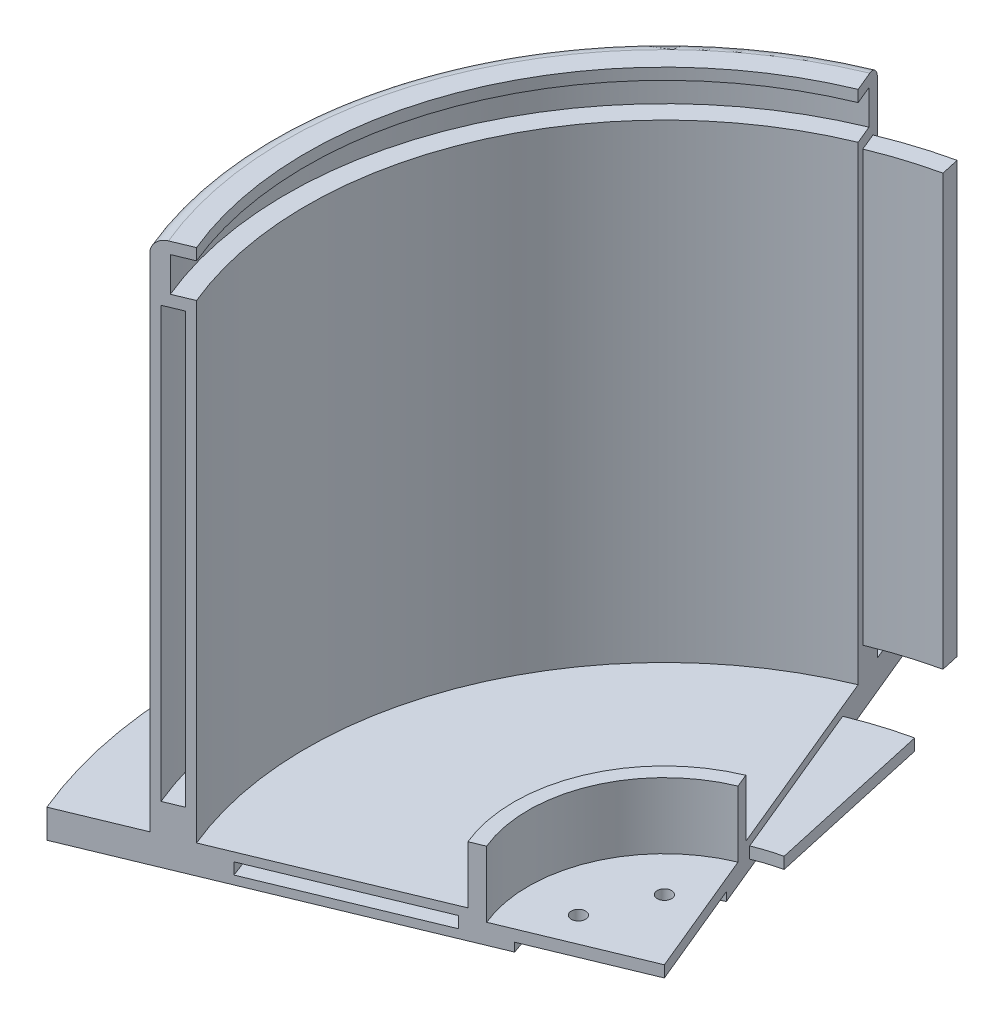
from build123d import *

# Parameters (mm, degrees)
SKETCH1_R           = 137.5
SKETCH1_R_2         = 125
BOSS_EXTRUDE1_DEPTH = 180
SKETCH2_R           = 165
SKETCH2_R_2         = 2.5
BOSS_EXTRUDE2_DEPTH = 10
SKETCH3_R           = 52.5
SKETCH3_R_2         = 47.5
BOSS_EXTRUDE3_DEPTH = 20
SKETCH4_W           = 56
SKETCH4_H           = 96
CUT_EXTRUDE4_DEPTH  = 150
SKETCH5_W           = 56
SKETCH5_H           = 10
BOSS_EXTRUDE4_DEPTH = 56
SKETCH6_W           = 56
SKETCH6_H           = 56
BOSS_EXTRUDE5_DEPTH = 10
SKETCH7_R           = 2.5
SKETCH7_R_2         = 12.5
CUT_EXTRUDE5_DEPTH  = 10
SKETCH8_W           = 56
SKETCH8_H           = 86
BOSS_EXTRUDE6_DEPTH = 5
FILLET1_R           = 10
FILLET2_R           = 5
SKETCH9_W           = 31.730677801
SKETCH9_H           = 6
CUT_EXTRUDE6_DEPTH  = 10
FILLET3_R           = 5
CUT_EXTRUDE7_START  = -3
SKETCH10_R          = 47.5
CUT_EXTRUDE7_DEPTH  = 3
SKETCH11_R          = 5
CUT_EXTRUDE8_DEPTH  = 5
SKETCH13_W          = 14
SKETCH13_H          = 12
CUT_EXTRUDE9_DEPTH  = 301.915270467
SKETCH15_W          = 6.5
SKETCH15_H          = 150
SKETCH15_W_2        = 60
SKETCH15_H_2        = 4
REVOLVE1_ANGLE      = 10
SKETCH16_W          = 6.5
SKETCH16_H          = 150
SKETCH16_W_2        = 60
SKETCH16_H_2        = 4
CUT_REVOLVE2_ANGLE  = 10
SKETCH17_R          = 40
CUT_EXTRUDE10_DEPTH = 3


with BuildPart() as part:
    # Sketch1 → Boss-Extrude1 (new body)
    with BuildSketch(Plane(origin=(0, 0, 0), x_dir=(1, 0, 0), z_dir=(0, 1, 0))):
        with Locations(Location((0, 0, 0), (0, 0, 90))):
            Circle(SKETCH1_R)
        with Locations(Location((0, 0, 0), (0, 0, 90))):
            Circle(SKETCH1_R_2, mode=Mode.SUBTRACT)
    extrude(amount=BOSS_EXTRUDE1_DEPTH)

    # Sketch2 → Boss-Extrude2 (add)
    with BuildSketch(Plane.XZ):
        with Locations(Location((0, 0, 0), (0, 0, 270))):
            Circle(SKETCH2_R)
        with Locations(Location((0, 150, 0), (0, 0, 270))):
            Circle(SKETCH2_R_2, mode=Mode.SUBTRACT)
        with Locations(Location((0, 30, 0), (0, 0, 270))):
            Circle(SKETCH2_R_2, mode=Mode.SUBTRACT)
        with Locations(Location((106.066017178, 106.066017178, 0), (0, 0, 270))):
            Circle(SKETCH2_R_2, mode=Mode.SUBTRACT)
        with Locations(Location((150, 0, 0), (0, 0, 270))):
            Circle(SKETCH2_R_2, mode=Mode.SUBTRACT)
        with Locations(Location((106.066017178, -106.066017178, 0), (0, 0, 270))):
            Circle(SKETCH2_R_2, mode=Mode.SUBTRACT)
        with Locations(Location((0, -150, 0), (0, 0, 270))):
            Circle(SKETCH2_R_2, mode=Mode.SUBTRACT)
        with Locations(Location((-106.066017178, -106.066017178, 0), (0, 0, 270))):
            Circle(SKETCH2_R_2, mode=Mode.SUBTRACT)
        with Locations(Location((-150, 0, 0), (0, 0, 270))):
            Circle(SKETCH2_R_2, mode=Mode.SUBTRACT)
        with Locations(Location((-106.066017178, 106.066017178, 0), (0, 0, 270))):
            Circle(SKETCH2_R_2, mode=Mode.SUBTRACT)
        with Locations(Location((21.213203436, 21.213203436, 0), (0, 0, 270))):
            Circle(SKETCH2_R_2, mode=Mode.SUBTRACT)
        with Locations(Location((30, 0, 0), (0, 0, 270))):
            Circle(SKETCH2_R_2, mode=Mode.SUBTRACT)
        with Locations(Location((21.213203436, -21.213203436, 0), (0, 0, 270))):
            Circle(SKETCH2_R_2, mode=Mode.SUBTRACT)
        with Locations(Location((0, -30, 0), (0, 0, 270))):
            Circle(SKETCH2_R_2, mode=Mode.SUBTRACT)
        with Locations(Location((-21.213203436, -21.213203436, 0), (0, 0, 270))):
            Circle(SKETCH2_R_2, mode=Mode.SUBTRACT)
        with Locations(Location((-30, 0, 0), (0, 0, 270))):
            Circle(SKETCH2_R_2, mode=Mode.SUBTRACT)
        with Locations(Location((-21.213203436, 21.213203436, 0), (0, 0, 270))):
            Circle(SKETCH2_R_2, mode=Mode.SUBTRACT)
    extrude(amount=BOSS_EXTRUDE2_DEPTH)

    # Sketch3 → Boss-Extrude3 (add)
    with BuildSketch(Plane(origin=(0, 0, 0), x_dir=(1, 0, 0), z_dir=(0, 1, 0))):
        with Locations(Location((0, 0, 0), (0, 0, 90))):
            Circle(SKETCH3_R)
        with Locations(Location((0, 0, 0), (0, 0, 270))):
            Circle(SKETCH3_R_2, mode=Mode.SUBTRACT)
    extrude(amount=BOSS_EXTRUDE3_DEPTH)

    # Sketch4 → Cut-Extrude4 (cut)
    with BuildSketch(Plane(origin=(0, 0, 0), x_dir=(0, 0, -1), z_dir=(1, 0, 0))):
        with Locations((0, 112)):
            Rectangle(SKETCH4_W, SKETCH4_H)
    extrude(amount=CUT_EXTRUDE4_DEPTH, mode=Mode.SUBTRACT)

    # Sketch5 → Boss-Extrude4 (add)
    with BuildSketch(Plane(origin=(0, 0, 28), x_dir=(-1, 0, 0), z_dir=(0, 0, -1))):
        with Locations((-121.823643025, 135)):
            Rectangle(SKETCH5_W, SKETCH5_H)
    extrude(amount=BOSS_EXTRUDE4_DEPTH)

    # Sketch6 → Boss-Extrude5 (add)
    with BuildSketch(Plane(origin=(0, 64, 0), x_dir=(1, 0, 0), z_dir=(0, 1, 0))):
        with Locations((121.823643025, 0)):
            Rectangle(SKETCH6_W, SKETCH6_H)
    extrude(amount=-BOSS_EXTRUDE5_DEPTH)

    # Sketch7 → Cut-Extrude5 (cut)
    with BuildSketch(Plane(origin=(0, 140, 0), x_dir=(1, 0, 0), z_dir=(0, 1, 0))):
        with Locations(Location((98.273643025, 23.55, 0), (0, 0, 270))):
            Circle(SKETCH7_R)
        with Locations(Location((145.373643025, 23.55, 0), (0, 0, 270))):
            Circle(SKETCH7_R)
        with Locations(Location((98.273643025, -23.55, 0), (0, 0, 270))):
            Circle(SKETCH7_R)
        with Locations(Location((145.373643025, -23.55, 0), (0, 0, 270))):
            Circle(SKETCH7_R)
        with Locations(Location((121.823643025, 0, 0), (0, 0, 270))):
            Circle(SKETCH7_R_2)
    extrude(amount=-CUT_EXTRUDE5_DEPTH, mode=Mode.SUBTRACT)

    # Sketch8 → Boss-Extrude6 (add)
    with BuildSketch(Plane(origin=(149.823643025, 0, 0), x_dir=(0, 0, -1), z_dir=(1, 0, 0))):
        with Locations((0, 97)):
            Rectangle(SKETCH8_W, SKETCH8_H)
    extrude(amount=BOSS_EXTRUDE6_DEPTH)

    # Fillet1
    # the kernel refuses this fillet: 10 mm, written as the material it takes off along each edge
    with BuildSketch(Plane(origin=(154.823643025, 165, -28), x_dir=(0, 0, 1), z_dir=(0, -1, 0))) as fillet1_piece_1:
        with BuildLine():
            CenterArc((FILLET1_R, FILLET1_R), FILLET1_R, 180, 90)
            Line((0, FILLET1_R), (0, 0))
            Line((0, 0), (FILLET1_R, 0))
        make_face()
    extrude(amount=136, mode=Mode.SUBTRACT)
    with BuildSketch(Plane(origin=(154.823643025, 29, 28), x_dir=(-1, 0, 0), z_dir=(0, 1, 0))) as fillet1_piece_2:
        with BuildLine():
            CenterArc((FILLET1_R, -FILLET1_R), FILLET1_R, 90, 90)
            Line((0, -FILLET1_R), (0, 0))
            Line((0, 0), (FILLET1_R, 0))
        make_face()
    extrude(amount=136, mode=Mode.SUBTRACT)

    # Fillet2
    fillet2_edges = [part.edges().sort_by_distance(p)[0] for p in [
        (93.823643025, 59, 28),
        (93.823643025, 59, -28),
        (93.823643025, 135, -28),
        (93.823643025, 135, 28),
    ]]
    fillet(fillet2_edges, radius=FILLET2_R)

    # Sketch9 → Cut-Extrude6 (cut)
    with BuildSketch(Plane(origin=(0, 140, 0), x_dir=(1, 0, 0), z_dir=(0, 1, 0))):
        with Locations((93.823643026, 0)):
            Rectangle(SKETCH9_W, SKETCH9_H)
    extrude(amount=-CUT_EXTRUDE6_DEPTH, mode=Mode.SUBTRACT)

    # Fillet3
    fillet3_edges = [part.edges().sort_by_distance(p)[0] for p in [
        (0, 180, 137.5),
    ]]
    fillet(fillet3_edges, radius=FILLET3_R)

    # Sketch10 → Cut-Extrude7 (cut)
    with BuildSketch(Plane(origin=(0, 0, 0), x_dir=(1, 0, 0), z_dir=(0, 1, 0)).offset(CUT_EXTRUDE7_START)):
        with Locations(Location((0, 0, 0), (0, 0, 270))):
            Circle(SKETCH10_R)
    extrude(amount=CUT_EXTRUDE7_DEPTH, mode=Mode.SUBTRACT)

    # Sketch11 → Cut-Extrude8 (cut)
    with BuildSketch(Plane(origin=(0, 0, 0), x_dir=(1, 0, 0), z_dir=(0, 1, 0))):
        with Locations(Location((0, 150, 0), (0, 0, 270))):
            Circle(SKETCH11_R)
        with Locations(Location((106.066017178, 106.066017178, 0), (0, 0, 270))):
            Circle(SKETCH11_R)
        with Locations(Location((150, 0, 0), (0, 0, 270))):
            Circle(SKETCH11_R)
        with Locations(Location((106.066017178, -106.066017178, 0), (0, 0, 270))):
            Circle(SKETCH11_R)
        with Locations(Location((0, -150, 0), (0, 0, 270))):
            Circle(SKETCH11_R)
        with Locations(Location((-106.066017178, -106.066017178, 0), (0, 0, 270))):
            Circle(SKETCH11_R)
        with Locations(Location((-150, 0, 0), (0, 0, 270))):
            Circle(SKETCH11_R)
        with Locations(Location((-106.066017178, 106.066017178, 0), (0, 0, 270))):
            Circle(SKETCH11_R)
    extrude(amount=-CUT_EXTRUDE8_DEPTH, mode=Mode.SUBTRACT)

    # Sketch13 → Cut-Revolve1 (revolve, cut)
    with BuildSketch(Plane.XY, mode=Mode.PRIVATE) as cut_revolve1_sk:
        with Locations((-125, 170)):
            Rectangle(SKETCH13_W, SKETCH13_H)
    revolve(cut_revolve1_sk.sketch.rotate(Axis((0, 0, 0), (0, 1, 0)), 90), axis=Axis((0, 0, 0), (0, 1, 0)), mode=Mode.SUBTRACT)

    # Sketch14 → Cut-Extrude9 (cut, through all)
    with BuildSketch(Plane(origin=(0, 180, 0), x_dir=(1, 0, 0), z_dir=(0, 1, 0))):
        with BuildLine():
            Line((-47.835429046, 115.484941564), (0, 0))
            Line((0, 0), (115.484941564, 47.835429046))
            ThreePointArc((115.484941564, 47.835429046), (47.835429046, 115.484941564), (-47.835429046, 115.484941564))
        make_face()
        with BuildLine():
            ThreePointArc((-47.835429046, 115.484941564), (47.835429046, 115.484941564), (115.484941564, 47.835429046))
            Line((115.484941564, 47.835429046), (122.414038058, 50.705554788))
            ThreePointArc((122.414038058, 50.705554788), (50.705554788, 122.414038058), (-50.705554788, 122.414038058))
            Line((-50.705554788, 122.414038058), (-47.835429046, 115.484941564))
        make_face()
        with BuildLine():
            ThreePointArc((-50.705554788, 122.414038058), (50.705554788, 122.414038058), (122.414038058, 50.705554788))
            Line((122.414038058, 50.705554788), (152.440122864, 63.14276634))
            ThreePointArc((152.440122864, 63.14276634), (63.14276634, 152.440122864), (-63.14276634, 152.440122864))
            Line((-63.14276634, 152.440122864), (-50.705554788, 122.414038058))
        make_face()
        with BuildLine():
            Line((152.440122864, 63.14276634), (122.414038058, 50.705554788))
            ThreePointArc((122.414038058, 50.705554788), (129.954049653, 25.849467667), (132.5, 0))
            Line((132.5, 0), (165, 0))
            ThreePointArc((165, 0), (161.829571267, 32.189903133), (152.440122864, 63.14276634))
        make_face()
        with BuildLine():
            Line((115.484941564, 47.835429046), (0, 0))
            Line((0, 0), (125, 0))
            ThreePointArc((125, 0), (122.59816005, 24.386290252), (115.484941564, 47.835429046))
        make_face()
        with BuildLine():
            Line((122.414038058, 50.705554788), (115.484941564, 47.835429046))
            ThreePointArc((115.484941564, 47.835429046), (122.59816005, 24.386290252), (125, 0))
            Line((125, 0), (132.5, 0))
            ThreePointArc((132.5, 0), (129.954049653, 25.849467667), (122.414038058, 50.705554788))
        make_face()
        with BuildLine():
            ThreePointArc((132.5, 0), (110.16972363, -73.613055875), (50.705554788, -122.414038058))
            Line((50.705554788, -122.414038058), (63.14276634, -152.440122864))
            ThreePointArc((63.14276634, -152.440122864), (137.19248603, -91.669088448), (165, 0))
            Line((165, 0), (132.5, 0))
        make_face()
        with BuildLine():
            ThreePointArc((125, 0), (103.933701538, -69.446279127), (47.835429046, -115.484941564))
            Line((47.835429046, -115.484941564), (50.705554788, -122.414038058))
            ThreePointArc((50.705554788, -122.414038058), (110.16972363, -73.613055875), (132.5, 0))
            Line((132.5, 0), (125, 0))
        make_face()
        with BuildLine():
            Line((125, 0), (0, 0))
            Line((0, 0), (47.835429046, -115.484941564))
            ThreePointArc((47.835429046, -115.484941564), (103.933701538, -69.446279127), (125, 0))
        make_face()
        with BuildLine():
            ThreePointArc((50.705554788, -122.414038058), (-50.705554788, -122.414038058), (-122.414038058, -50.705554788))
            Line((-122.414038058, -50.705554788), (-152.440122864, -63.14276634))
            ThreePointArc((-152.440122864, -63.14276634), (-63.14276634, -152.440122864), (63.14276634, -152.440122864))
            Line((63.14276634, -152.440122864), (50.705554788, -122.414038058))
        make_face()
        with BuildLine():
            ThreePointArc((47.835429046, -115.484941564), (-47.835429046, -115.484941564), (-115.484941564, -47.835429046))
            Line((-115.484941564, -47.835429046), (-122.414038058, -50.705554788))
            ThreePointArc((-122.414038058, -50.705554788), (-50.705554788, -122.414038058), (50.705554788, -122.414038058))
            Line((50.705554788, -122.414038058), (47.835429046, -115.484941564))
        make_face()
        with BuildLine():
            Line((47.835429046, -115.484941564), (0, 0))
            Line((0, 0), (-115.484941564, -47.835429046))
            ThreePointArc((-115.484941564, -47.835429046), (-47.835429046, -115.484941564), (47.835429046, -115.484941564))
        make_face()
    extrude(amount=-CUT_EXTRUDE9_DEPTH, mode=Mode.SUBTRACT)

    # Sketch15 → Revolve1 (revolve)
    with BuildSketch(Plane(origin=(0, 0, 0), x_dir=(-0.38268343236509034, 0, -0.9238795325112865), z_dir=(0.9238795325112865, 0, -0.38268343236509034))):
        with Locations((131.25, 85)):
            Rectangle(SKETCH15_W, SKETCH15_H)
        with Locations((85, -5)):
            Rectangle(SKETCH15_W_2, SKETCH15_H_2)
    revolve(axis=Axis((0, 0, 0), (0, -1, 0)), revolution_arc=REVOLVE1_ANGLE)

    # Sketch16 → Cut-Revolve2 (revolve, cut)
    with BuildSketch(Plane(origin=(0, 0, 0), x_dir=(0.9238795325112864, 0, -0.3826834323650908), z_dir=(0.3826834323650908, 0, 0.9238795325112864))):
        with Locations((-131.25, 85)):
            Rectangle(SKETCH16_W, SKETCH16_H)
        with Locations((-85, -5)):
            Rectangle(SKETCH16_W_2, SKETCH16_H_2)
    revolve(axis=Axis((0, 0, 0), (0, -1, 0)), revolution_arc=CUT_REVOLVE2_ANGLE, mode=Mode.SUBTRACT)

    # Sketch17 → Cut-Extrude10 (cut)
    with BuildSketch(Plane.XZ.offset(10)):
        Circle(SKETCH17_R)
    extrude(amount=-CUT_EXTRUDE10_DEPTH, mode=Mode.SUBTRACT)


solid = part.part
